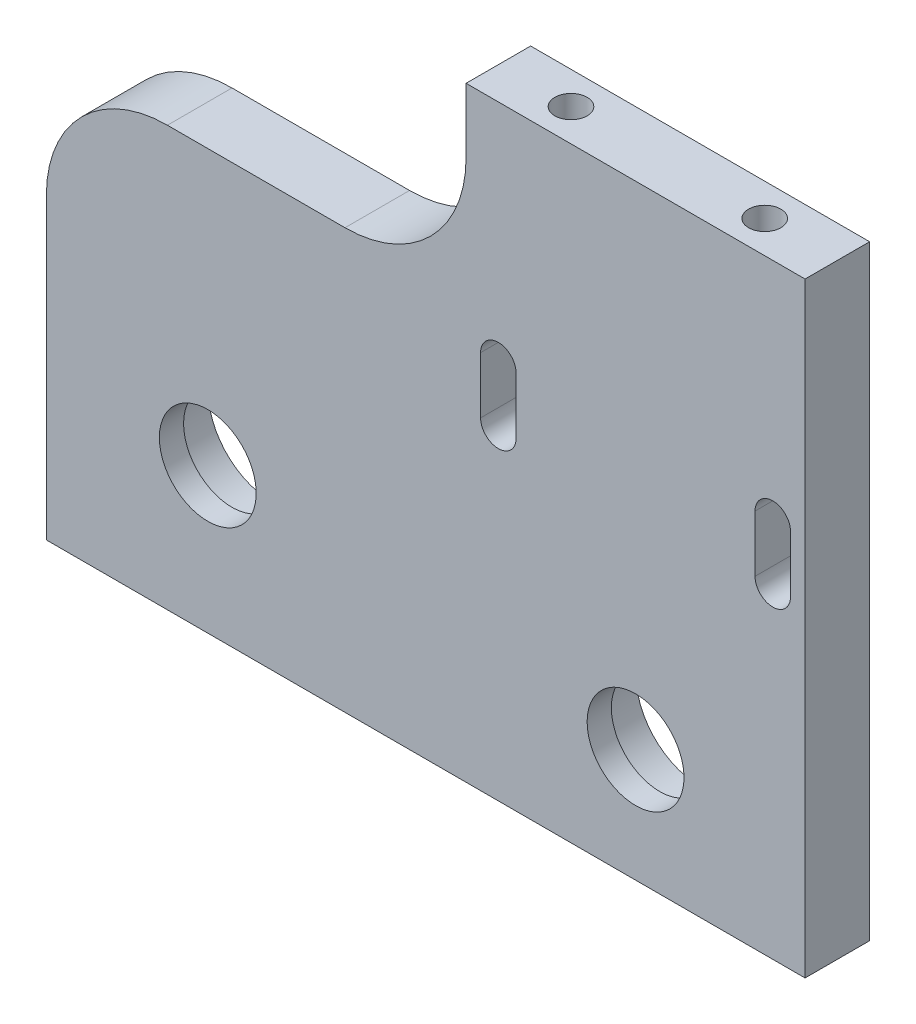
from build123d import *

# Parameters (mm, degrees)
BOSS_EXTRU_1_DEPTH      = 8
ESQUISSE2_R             = 7.95
ENL_V_MAT_EXTRU_1_DEPTH = 5
ESQUISSE3_R             = 6
ENL_V_MAT_EXTRU_2_DEPTH = 121.357799913
ENL_V_MAT_EXTRU_3_DEPTH = 121.519707932
ESQUISSE5_R             = 2
ENL_V_MAT_EXTRU_4_DEPTH = 30
CONG_1_R                = 15
ESQUISSE6_R             = 2
ENL_V_MAT_EXTRU_5_DEPTH = 20


with BuildPart() as part:
    # Esquisse1 → Boss.-Extru.1 (new body)
    with BuildSketch(Plane.XY):
        Polygon((52, 75), (52, 52), (0, 52), (0, 0), (94, 0), (94, 75), align=None)
    extrude(amount=BOSS_EXTRU_1_DEPTH)

    # Esquisse2 → Enlèv. mat.-Extru.1 (cut)
    with BuildSketch(Plane(origin=(0, 0, 0), x_dir=(-1, 0, 0), z_dir=(0, 0, -1))):
        with Locations((-20, 18)):
            Circle(ESQUISSE2_R)
        with Locations((-73, 14)):
            Circle(ESQUISSE2_R)
    extrude(amount=-ENL_V_MAT_EXTRU_1_DEPTH, mode=Mode.SUBTRACT)

    # Esquisse3 → Enlèv. mat.-Extru.2 (cut, through all)
    with BuildSketch(Plane(origin=(0, 0, 5), x_dir=(-1, 0, 0), z_dir=(0, 0, -1))):
        with Locations((-73, 14)):
            Circle(ESQUISSE3_R)
        with Locations((-20, 18)):
            Circle(ESQUISSE3_R)
    extrude(amount=-ENL_V_MAT_EXTRU_2_DEPTH, mode=Mode.SUBTRACT)

    # Esquisse4 → Enlèv. mat.-Extru.3 (cut, through all)
    with BuildSketch(Plane(origin=(0, 0, 0), x_dir=(-1, 0, 0), z_dir=(0, 0, -1))):
        with BuildLine():
            Line((-92.2, 40), (-92.2, 47))
            ThreePointArc((-92.2, 47), (-90, 49.2), (-87.8, 47))
            Line((-87.8, 47), (-87.8, 40))
            ThreePointArc((-87.8, 40), (-90, 37.8), (-92.2, 40))
        make_face()
        with BuildLine():
            Line((-53.8, 40), (-53.8, 47))
            ThreePointArc((-53.8, 47), (-56, 49.2), (-58.2, 47))
            Line((-58.2, 47), (-58.2, 40))
            ThreePointArc((-58.2, 40), (-56, 37.8), (-53.8, 40))
        make_face()
    extrude(amount=-ENL_V_MAT_EXTRU_3_DEPTH, mode=Mode.SUBTRACT)

    # Esquisse5 → Enlèv. mat.-Extru.4 (cut)
    with BuildSketch(Plane(origin=(0, 75, 0), x_dir=(1, 0, 0), z_dir=(0, 1, 0))):
        with Locations((61, -4)):
            Circle(ESQUISSE5_R)
        with Locations((85, -4)):
            Circle(ESQUISSE5_R)
    extrude(amount=-ENL_V_MAT_EXTRU_4_DEPTH, mode=Mode.SUBTRACT)

    # Congé1
    cong_1_edges = [part.edges().sort_by_distance(p)[0] for p in [
        (0, 52, 4),
        (52, 52, 4),
    ]]
    fillet(cong_1_edges, radius=CONG_1_R)

    # Esquisse6 → Enlèv. mat.-Extru.5 (cut)
    with BuildSketch(Plane.XZ):
        with Locations((6, 4)):
            Circle(ESQUISSE6_R)
        with Locations((88, 4)):
            Circle(ESQUISSE6_R)
    extrude(amount=-ENL_V_MAT_EXTRU_5_DEPTH, mode=Mode.SUBTRACT)


solid = part.part
